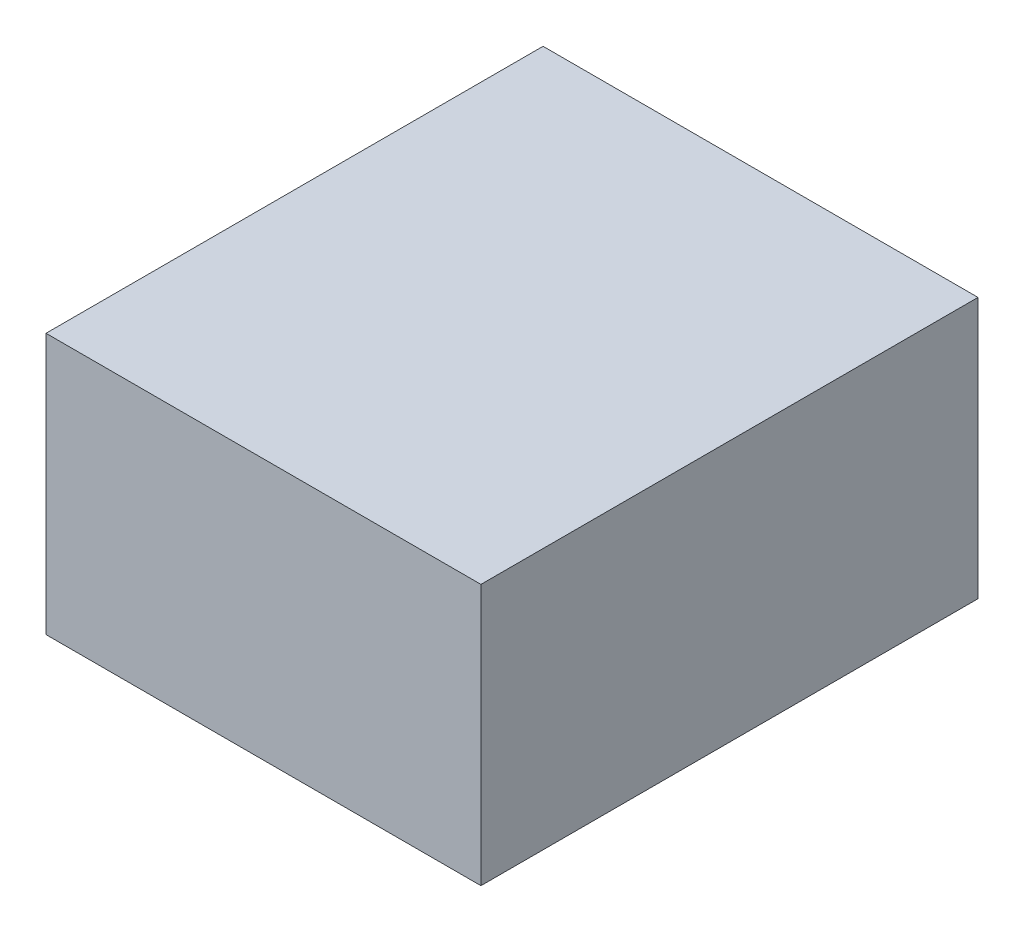
from build123d import *

# Parameters (mm, degrees)
SKETCH1_W           = 8.89
SKETCH1_H           = 5.334
BOSS_EXTRUDE1_DEPTH = 10.16


with BuildPart() as part:
    # Sketch1 → Boss-Extrude1 (new body)
    with BuildSketch(Plane.XY):
        with Locations((-0.160389822, 2.568239623)):
            Rectangle(SKETCH1_W, SKETCH1_H)
    extrude(amount=BOSS_EXTRUDE1_DEPTH)


solid = part.part
